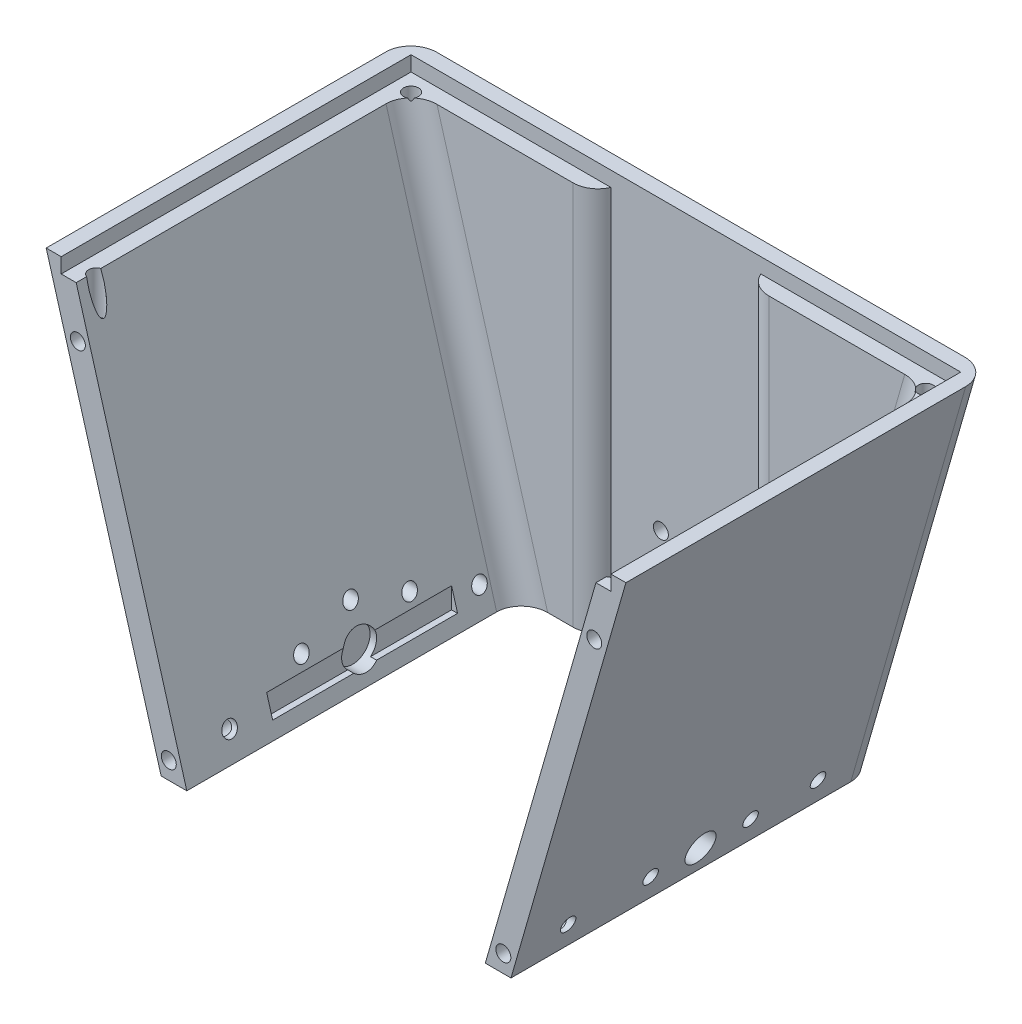
from build123d import *

# Parameters (mm, degrees)
BOSS_EXTRUDE1_DEPTH     = 76
CUT_EXTRUDE1_DEPTH      = 3
CUT_EXTRUDE2_DEPTH      = 70
SKETCH4_W               = 116
SKETCH4_H               = 3
CUT_EXTRUDE3_DEPTH      = 95.00000000000003
FILLET1_R               = 5
FILLET2_R               = 5
SKETCH6_R               = 1.500000000000004
SKETCH6_R_2             = 1.4999999999999971
SKETCH6_R_3             = 1.4999999999999973
SKETCH6_R_4             = 1.5000000000000042
CUT_EXTRUDE4_DEPTH      = 10
SKETCH7_W               = 29.999999999999996
SKETCH7_H               = 5.999999999999984
CUT_EXTRUDE5_DEPTH      = 93.00000000000001
FILLET3_R               = 5
FILLET4_R               = 5
SKETCH8_R               = 1.4999999999999991
SKETCH8_R_2             = 1.5000000000000009
CUT_EXTRUDE6_DEPTH      = 93.00000000000001
SKETCH9_R               = 1.5000000000000009
SKETCH9_R_2             = 1.5000000000000042
SKETCH9_R_3             = 1.4999999999999973
CUT_EXTRUDE7_DEPTH      = 15
FILLET5_R               = 5
FILLET6_R               = 5
CUT_EXTRUDE8_DEPTH      = 30
CUT_EXTRUDE8_DEPTH_BACK = 70
SKETCH10_R              = 1.4999999999999973
SKETCH10_R_2            = 1.5000000000000009
SKETCH12_R              = 3.500000000000001
CUT_EXTRUDE9_DEPTH      = 45.6894054301587
SKETCH13_R              = 3.0000000000000018
CUT_EXTRUDE10_DEPTH     = 39.63321669991409
SKETCH15_W              = 37.000000000000014
SKETCH15_H              = 5.299999999999997
CUT_EXTRUDE13_DEPTH     = 44.38
SKETCH17_R              = 1.5000000000000042
SKETCH17_R_2            = 1.5000000000000009
CUT_EXTRUDE14_DEPTH     = 58.70047510000001
SKETCH18_R              = 1.5000000000000042
CUT_EXTRUDE15_DEPTH     = 58.70047510000001
SKETCH19_R              = 1.5000000000000042
SKETCH19_R_2            = 1.5000000000000009
CUT_EXTRUDE16_DEPTH     = 58.70047510000001


with BuildPart() as part:
    # Sketch1 → Boss-Extrude1 (new body)
    with BuildSketch(Plane.XY):
        Polygon((-70.49492385786803, 0), (45.505076142131976, 0), (22.50507614213199, -80), (-12.494923857868015, -80), (-47.494923857868024, -80), align=None)
    extrude(amount=BOSS_EXTRUDE1_DEPTH)

    # Sketch2 → Cut-Extrude1 (cut)
    with BuildSketch(Plane(origin=(0, 0, 0), x_dir=(1, 0, 0), z_dir=(0, 1, 0))):
        Polygon((-67.49492385786803, -3), (42.505076142131976, -3), (42.50507614213198, -73), (-67.49492385786802, -73), align=None)
    extrude(amount=-CUT_EXTRUDE1_DEPTH, mode=Mode.SUBTRACT)

    # Sketch3 → Cut-Extrude2 (cut)
    with BuildSketch(Plane.XY.offset(76)):
        Polygon((-42.069840297681274, -81), (17.079992581945223, -81), (39.505076142131976, -3.0000000000000124), (-64.49492385786802, -3.0000000000000124), align=None)
    extrude(amount=-CUT_EXTRUDE2_DEPTH, mode=Mode.SUBTRACT)

    # Sketch4 → Cut-Extrude3 (cut)
    with BuildSketch(Plane(origin=(0, 0, 0), x_dir=(1, 0, 0), z_dir=(0, 1, 0))):
        with Locations((-12.494923857868027, -74.5)):
            Rectangle(SKETCH4_W, SKETCH4_H)
    extrude(amount=-CUT_EXTRUDE3_DEPTH, mode=Mode.SUBTRACT)

    # Fillet1
    fillet1_edges = [part.edges().sort_by_distance(p)[0] for p in [
        (28.43628489768082, -41.50000000000001, 6),
    ]]
    fillet(fillet1_edges, radius=FILLET1_R)

    # Fillet2
    fillet2_edges = [part.edges().sort_by_distance(p)[0] for p in [
        (-53.42613261341687, -41.500000000000014, 6),
    ]]
    fillet(fillet2_edges, radius=FILLET2_R)

    # Sketch6 → Cut-Extrude4 (cut)
    with BuildSketch(Plane(origin=(0, -3, 0), x_dir=(1, 0, 0), z_dir=(0, 1, 0))):
        with Locations(Location((39.005076142131976, -6.500000000000005, 0), (0, 0, 270))):
            Circle(SKETCH6_R)
        with Locations(Location((-63.994923857868024, -6.500000000000001, 0), (0, 0, 270))):
            Circle(SKETCH6_R_2)
        with Locations(Location((-63.994923857868024, -69.49999999999999, 0), (0, 0, 270))):
            Circle(SKETCH6_R_3)
        with Locations(Location((39.00507614213195, -69.49999999999999, 0), (0, 0, 270))):
            Circle(SKETCH6_R_4)
    extrude(amount=-CUT_EXTRUDE4_DEPTH, mode=Mode.SUBTRACT)

    # Sketch7 → Cut-Extrude5 (cut)
    with BuildSketch(Plane(origin=(0, -3, 0), x_dir=(1, 0, 0), z_dir=(0, 1, 0))):
        with Locations((-12.494923857868004, -5.999999999999992)):
            Rectangle(SKETCH7_W, SKETCH7_H)
    extrude(amount=-CUT_EXTRUDE5_DEPTH, mode=Mode.SUBTRACT)

    # Fillet3
    fillet3_edges = [part.edges().sort_by_distance(p)[0] for p in [
        (34.00507614213198, -40, 0),
    ]]
    fillet(fillet3_edges, radius=FILLET3_R)

    # Fillet4
    fillet4_edges = [part.edges().sort_by_distance(p)[0] for p in [
        (-58.99492385786803, -40, 0),
    ]]
    fillet(fillet4_edges, radius=FILLET4_R)

    # Sketch8 → Cut-Extrude6 (cut)
    with BuildSketch(Plane(origin=(0, 0, 0), x_dir=(-1, 0, 0), z_dir=(0, 0, -1))):
        with Locations((7.494923857868018, -65.49999999999999)):
            Circle(SKETCH8_R)
        with Locations((7.494923857868017, -57.49999999999999)):
            Circle(SKETCH8_R_2)
        with Locations((17.494923857868017, -57.49999999999999)):
            Circle(SKETCH8_R_2)
        with Locations((17.494923857868017, -65.49999999999999)):
            Circle(SKETCH8_R_2)
    extrude(amount=-CUT_EXTRUDE6_DEPTH, mode=Mode.SUBTRACT)

    # Sketch9 → Cut-Extrude7 (cut)
    with BuildSketch(Plane.XY.offset(73)):
        with Locations((20.975017364193207, -76.5)):
            Circle(SKETCH9_R)
        with Locations((-45.964865079929254, -76.5)):
            Circle(SKETCH9_R_2)
        with Locations((-64.15615463641093, -12.999999999999998)):
            Circle(SKETCH9_R_3)
        with Locations((39.166306920674884, -13.000000000000002)):
            Circle(SKETCH9_R_2)
    extrude(amount=-CUT_EXTRUDE7_DEPTH, mode=Mode.SUBTRACT)

    # Fillet5
    # the kernel refuses this fillet: 5 mm, written as the material it takes off along each edge
    with BuildSketch(Plane(origin=(2.505076142131994, -91.45643923738959, 6), x_dir=(1, 0, 0), z_dir=(0, 1, 0))) as fillet5_piece_1:
        with BuildLine():
            CenterArc((4.582575694955839, 5), FILLET5_R, 203.57817847820183, 66.42182152179817)
            Line((-8.9e-16, 2.9999999999999996), (-0.09165151389911763, 2.9599999999999995))
            ThreePointArc((-0.09165151389911763, 2.9599999999999995), (-0.09999999999999964, 1.5), (-0.10000000000000009, 0))
            Line((-0.10000000000000009, 0), (0, -0.09999999999999964))
            Line((0, -0.09999999999999964), (4.582575694955839, -0.09999999999999964))
            Line((4.582575694955839, -0.09999999999999964), (4.582575694955839, 0))
        make_face()
    extrude(amount=99.91287847477919, mode=Mode.SUBTRACT)

    # Fillet6
    # the kernel refuses this fillet: 5 mm, written as the material it takes off along each edge
    with BuildSketch(Plane(origin=(-27.494923857868002, 8.456439237389588, 6), x_dir=(1.18e-15, 0, -1), z_dir=(0, -1, 0))) as fillet6_piece_1:
        with BuildLine():
            CenterArc((4.999999999999995, -4.582575694955842), FILLET6_R, 113.57817847820179, 66.42182152179812)
            Line((-5.43e-15, -4.582575694955835), (-0.10000000000000507, -4.582575694955835))
            Line((-0.10000000000000507, -4.582575694955835), (-0.09999999999999964, 1.2e-16))
            Line((-0.09999999999999964, 1.2e-16), (1.2e-16, 0.10000000000000142))
            ThreePointArc((1.2e-16, 0.10000000000000142), (1.4999999999999993, 0.09999999999999964), (2.959999999999998, 0.0916515138991159))
            Line((2.959999999999998, 0.0916515138991159), (2.9999999999999982, 0))
        make_face()
    extrude(amount=99.91287847477918, mode=Mode.SUBTRACT)

    # Sketch10 → Cut-Extrude8 (cut, two sides: drawn at the far end of the back side and taken through both)
    with BuildSketch(Plane(origin=(0, 0, 0), x_dir=(0, 0, -1), z_dir=(1, 0, 0)).offset(-CUT_EXTRUDE8_DEPTH_BACK)):
        with Locations(Location((-63, -75, 0), (0, 0, 90))):
            Circle(SKETCH10_R)
        with Locations(Location((-12.999999999999998, -75, 0), (0, 0, 270))):
            Circle(SKETCH10_R_2)
    extrude(amount=CUT_EXTRUDE8_DEPTH + CUT_EXTRUDE8_DEPTH_BACK, mode=Mode.SUBTRACT)

    # Sketch12 → Cut-Extrude9 (cut)
    with BuildSketch(Plane(origin=(0, 0, 0), x_dir=(0, 0, -1), z_dir=(1, 0, 0))):
        with Locations((-36.5, -74.50000000000001)):
            Circle(SKETCH12_R)
    extrude(amount=-CUT_EXTRUDE9_DEPTH, mode=Mode.SUBTRACT)

    # Sketch13 → Cut-Extrude10 (cut)
    with BuildSketch(Plane(origin=(0, 0, 0), x_dir=(0, 0, -1), z_dir=(1, 0, 0))):
        with Locations(Location((-36.5, -75.00000000000001, 0), (0, 0, 270))):
            Circle(SKETCH13_R)
    extrude(amount=CUT_EXTRUDE10_DEPTH, mode=Mode.SUBTRACT)

    # Sketch15 → Cut-Extrude13 (cut)
    with BuildSketch(Plane(origin=(0, 0, 0), x_dir=(0, 0, -1), z_dir=(1, 0, 0))):
        with Locations((-36.5, -74.5)):
            Rectangle(SKETCH15_W, SKETCH15_H)
    extrude(amount=-CUT_EXTRUDE13_DEPTH, mode=Mode.SUBTRACT)

    # Sketch17 → Cut-Extrude14 (cut)
    with BuildSketch(Plane(origin=(0, 0, 0), x_dir=(0, 0, -1), z_dir=(1, 0, 0))):
        with Locations(Location((-47.32264338558277, -70.46469184619794, 0), (0, 0, 270))):
            Circle(SKETCH17_R)
        with Locations(Location((-25.677356614417228, -70.46469184619795, 0), (0, 0, 270))):
            Circle(SKETCH17_R_2)
    extrude(amount=-CUT_EXTRUDE14_DEPTH, mode=Mode.SUBTRACT)

    # Sketch18 → Cut-Extrude15 (cut)
    with BuildSketch(Plane(origin=(0, 0, 0), x_dir=(0, 0, -1), z_dir=(1, 0, 0))):
        with Locations(Location((-36.5, -67, 0), (0, 0, 270))):
            Circle(SKETCH18_R)
    extrude(amount=-CUT_EXTRUDE15_DEPTH, mode=Mode.SUBTRACT)

    # Sketch19 → Cut-Extrude16 (cut)
    with BuildSketch(Plane(origin=(0, 0, 0), x_dir=(0, 0, -1), z_dir=(1, 0, 0))):
        with Locations(Location((-46.5, -75.00000000000001, 0), (0, 0, 270))):
            Circle(SKETCH19_R)
        with Locations(Location((-26.499999999999996, -75.00000000000001, 0), (0, 0, 270))):
            Circle(SKETCH19_R_2)
    extrude(amount=CUT_EXTRUDE16_DEPTH, mode=Mode.SUBTRACT)


solid = part.part
